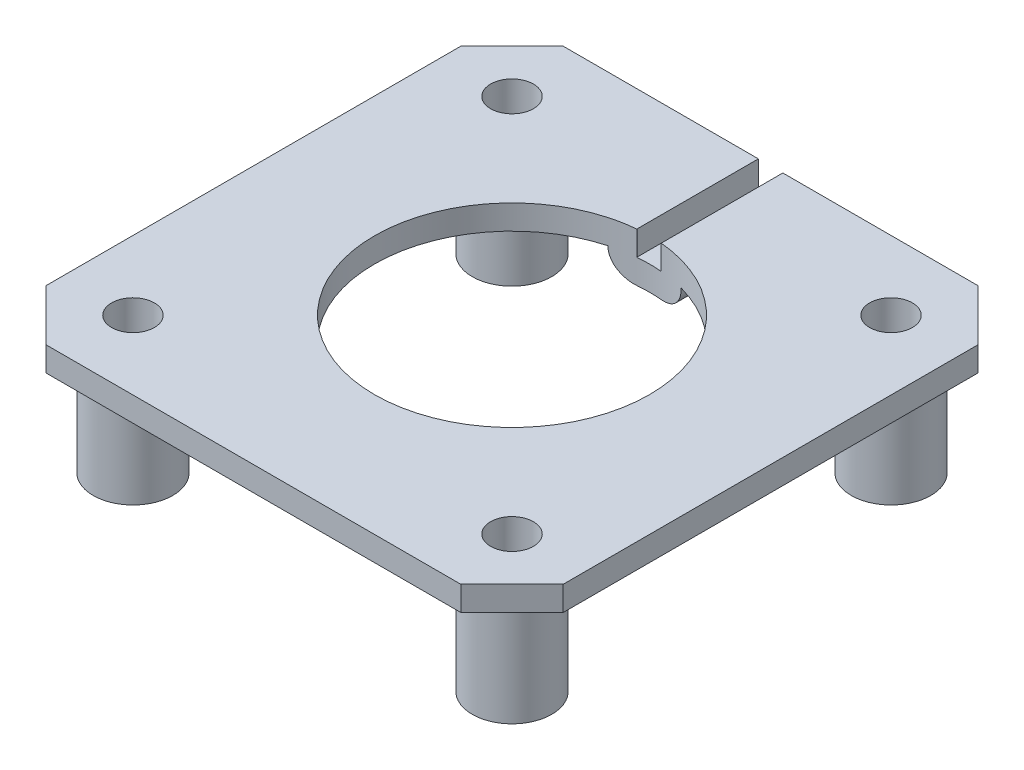
from build123d import *
from build123d.topology import SkipClean

# Parameters (mm, degrees)
SKETCH1_R               = 3.25
BOSS_EXTRUDE1_DEPTH     = 11.15
SKETCH2_W               = 42.3
SKETCH2_H               = 42.3
SKETCH2_R               = 11.25
BOSS_EXTRUDE2_DEPTH     = 2
CUT_EXTRUDE1_DEPTH      = 32.921270338
SKETCH4_R               = 1.75
CUT_EXTRUDE2_DEPTH      = 32.921270338
MIRROR6_COPY_1_SKETCH_R = 1.75
MIRROR6_COPY_1_DEPTH    = 32.921270338
BOSS_EXTRUDE3_DEPTH     = 2
CUT_EXTRUDE3_DEPTH      = 2
FILLET1_R               = 2


with BuildPart() as part:
    # Sketch1 → Boss-Extrude1 (new body)
    with BuildSketch(Plane(origin=(0, 0, 0), x_dir=(1, 0, 0), z_dir=(0, 1, 0))):
        with Locations(Location((-15.5, 15.5, 0), (0, 0, 270))):
            Circle(SKETCH1_R)
    extrude(amount=BOSS_EXTRUDE1_DEPTH)


with BuildPart() as body_2:
    # Mirror2: mirrored copy
    add(part.part.mirror(Plane(origin=(0, 0, 0), x_dir=(0, 0, 1), z_dir=(1, 0, 0))))


with BuildPart() as body_3:
    # Mirror3: mirrored copy
    add(part.part.mirror(Plane.XY))


with BuildPart() as body_4:
    # Mirror3 2: mirrored copy
    add(body_2.part.mirror(Plane.XY))


with BuildPart() as part_1:
    add(part.part)

    add(body_2.part)  # Boss-Extrude2 merges body 2

    add(body_3.part)  # Boss-Extrude2 merges body 3

    add(body_4.part)  # Boss-Extrude2 merges body 4
    # Sketch2 → Boss-Extrude2 (add)
    with BuildSketch(Plane(origin=(0, 11.15, 0), x_dir=(1, 0, 0), z_dir=(0, 1, 0))):
        Rectangle(SKETCH2_W, SKETCH2_H)
        with Locations(Location((0, 0, 0), (0, 0, 270))):
            Circle(SKETCH2_R, mode=Mode.SUBTRACT)
    extrude(amount=-BOSS_EXTRUDE2_DEPTH)

    # Sketch3 → Cut-Extrude1 (cut, through all)
    with BuildSketch(Plane(origin=(0, 11.15, 0), x_dir=(1, 0, 0), z_dir=(0, 1, 0))):
        Polygon((-16.963055506, 21.15), (-21.15, 16.963055506), (-21.15, 21.15), align=None)
        Polygon((16.963055506, -21.15), (21.15, -16.963055506), (21.15, -21.15), align=None)
    cut_extrude1 = extrude(amount=-CUT_EXTRUDE1_DEPTH, mode=Mode.SUBTRACT)

    # Mirror4: Cut-Extrude1 across plane
    add(cut_extrude1.mirror(Plane.XY), mode=Mode.SUBTRACT)

    # Sketch4 → Cut-Extrude2 (cut, through all)
    with BuildSketch(Plane.XZ):
        with Locations(Location((15.5, -15.5, 0), (0, 0, 270))):
            Circle(SKETCH4_R)
    cut_extrude2 = extrude(amount=-CUT_EXTRUDE2_DEPTH, mode=Mode.SUBTRACT)

    # Mirror5: Cut-Extrude2 across plane
    add(cut_extrude2.mirror(Plane(origin=(0, 0, 0), x_dir=(0, 0, 1), z_dir=(1, 0, 0))), mode=Mode.SUBTRACT)

    # Mirror6: Cut-Extrude2 across plane
    add(cut_extrude2.mirror(Plane.XY), mode=Mode.SUBTRACT)

    # Mirror6 copy 1 sketch → Mirror6 copy 1 (cut, through all)
    with BuildSketch(Plane(origin=(0, 0, 0), x_dir=(-1, 0, 0), z_dir=(0, -1, 0))):
        with Locations(Location((15.5, -15.5, 0), (0, 0, 270))):
            Circle(MIRROR6_COPY_1_SKETCH_R)
    extrude(amount=-MIRROR6_COPY_1_DEPTH, mode=Mode.SUBTRACT)

    # Sketch6 → Boss-Extrude3 (add)
    with SkipClean():  # the faces are left unmerged after this step: merging them gives an invalid solid
        with BuildSketch(Plane.XZ.offset(-9.15)):
            with BuildLine():
                Line((-3, -21.15), (-3, -10.842624221))
                ThreePointArc((-3, -10.842624221), (0, -11.25), (3, -10.842624221))
                Line((3, -10.842624221), (3, -21.15))
                Line((3, -21.15), (-3, -21.15))
            make_face()
        extrude(amount=BOSS_EXTRUDE3_DEPTH)

    # Sketch7 → Cut-Extrude3 (cut)
    with SkipClean():  # the faces are left unmerged after this step: merging them gives an invalid solid
        with BuildSketch(Plane(origin=(0, 11.15, 0), x_dir=(1, 0, 0), z_dir=(0, 1, 0))):
            with BuildLine():
                Line((-1, 11.25), (-1, 21.15))
                ThreePointArc((-1, 21.15), (0, 22.15), (1, 21.15))
                Line((1, 21.15), (1, 11.25))
                ThreePointArc((1, 11.25), (0, 10.25), (-1, 11.25))
            make_face()
        extrude(amount=-CUT_EXTRUDE3_DEPTH, mode=Mode.SUBTRACT)

    # Fillet1
    fillet1_edges = [part_1.edges().sort_by_distance(p)[0] for p in [
        (3, 7.15, -15.996312111),
        (-3, 7.15, -15.996312111),
    ]]
    fillet(fillet1_edges, radius=FILLET1_R - 0.0001)  # a hair under: the kernel refuses the full size


solid = part_1.part
